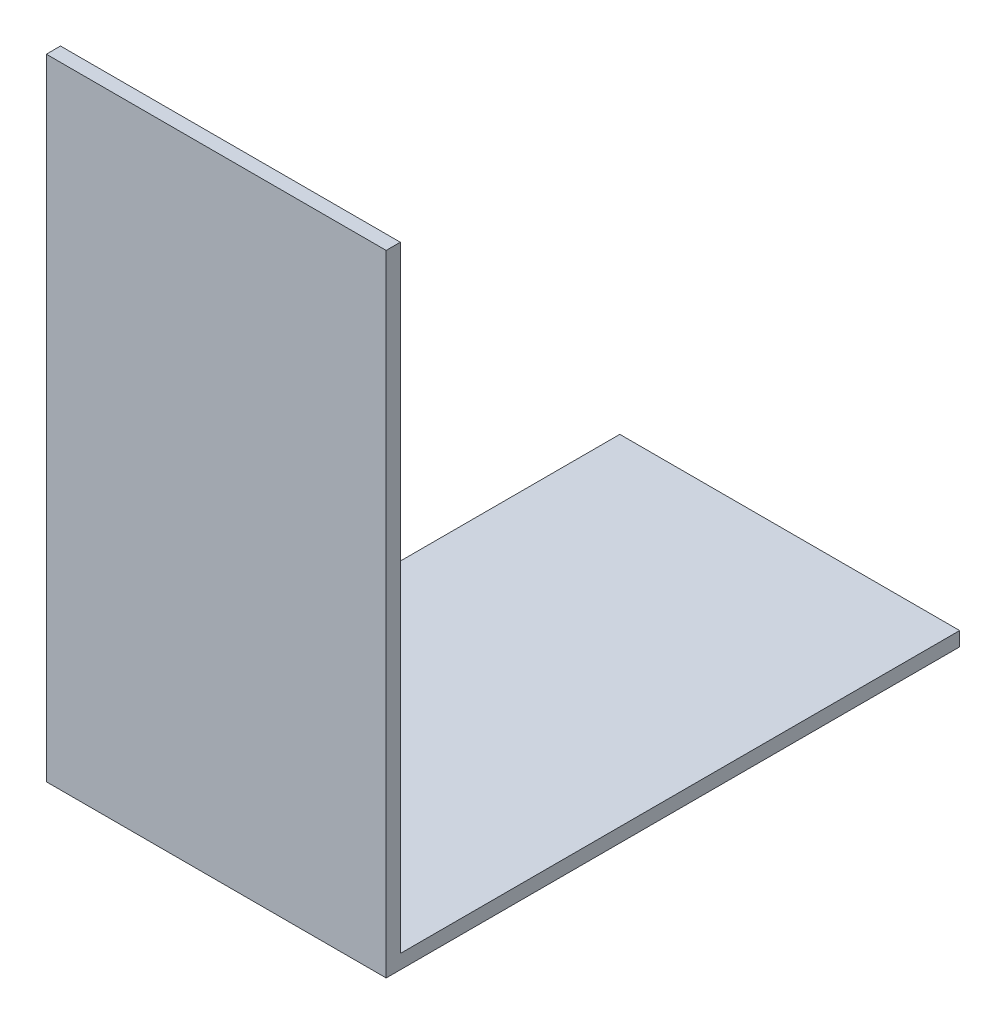
from build123d import *

# Parameters (mm, degrees)
BOSS_EXTRUDE1_DEPTH = 76.2


with BuildPart() as part:
    # Sketch1 → Boss-Extrude1 (new, symmetric)
    with BuildSketch(Plane(origin=(0, 0, 0), x_dir=(0, 0, -1), z_dir=(1, 0, 0))):
        Polygon((-3.175, 279.4), (-3.175, -3.175), (254, -3.175), (254, 3.175), (3.175, 3.175), (3.175, 279.4), align=None)
    extrude(amount=BOSS_EXTRUDE1_DEPTH, both=True)


solid = part.part
